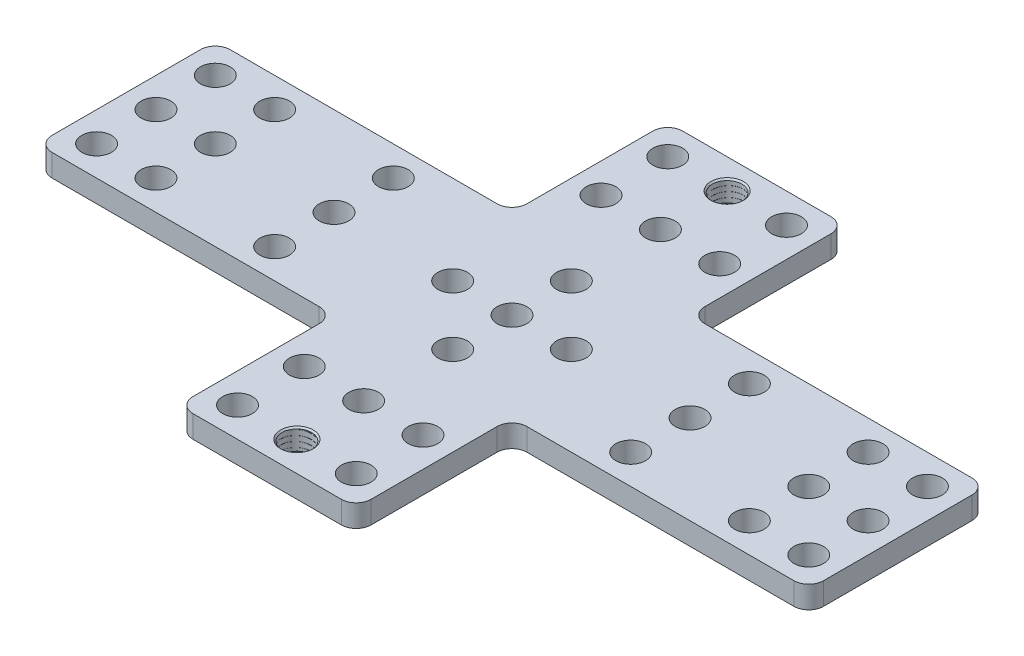
from build123d import *

# Parameters (mm, degrees)
SKETCH_1_R          = 2
EXTRUDE_1_DEPTH     = 3
SKETCH_2_R          = 2
CUT_EXTRUDE_1_DEPTH = 10
SKETCH_3_R          = 2
CUT_EXTRUDE_2_DEPTH = 10
SWEEP_1_PITCH       = 0.7


with BuildPart() as part:
    # 草图1 → 凸台-拉伸1 (new body)
    with BuildSketch(Plane(origin=(0, 0, 0), x_dir=(1, 0, 0), z_dir=(0, 1, 0))):
        with BuildLine():
            Line((-12, 14), (-12, 31))
            ThreePointArc((-12, 31), (-11.414213562, 32.414213562), (-10, 33))
            Line((-10, 33), (0, 33))
            Line((0, 33), (0, 31))
            ThreePointArc((0, 31), (-2, 29), (0, 27))
            Line((0, 27), (0, 10))
            ThreePointArc((0, 10), (-2, 8), (0, 6))
            Line((0, 6), (0, 2))
            ThreePointArc((0, 2), (-2, 0), (0, -2))
            Line((0, -2), (0, -6))
            ThreePointArc((0, -6), (-2, -8), (0, -10))
            Line((0, -10), (0, -27))
            ThreePointArc((0, -27), (-2, -29), (0, -31))
            Line((0, -31), (0, -33))
            Line((0, -33), (-10, -33))
            ThreePointArc((-10, -33), (-11.414213562, -32.414213562), (-12, -31))
            Line((-12, -31), (-12, -14))
            ThreePointArc((-12, -14), (-12.585786438, -12.585786438), (-14, -12))
            Line((-14, -12), (-50, -12))
            ThreePointArc((-50, -12), (-51.414213562, -11.414213562), (-52, -10))
            Line((-52, -10), (-52, 10))
            ThreePointArc((-52, 10), (-51.414213562, 11.414213562), (-50, 12))
            Line((-50, 12), (-14, 12))
            ThreePointArc((-14, 12), (-12.585786438, 12.585786438), (-12, 14))
        make_face()
        with Locations(Location((-48, 0, 0), (0, 0, 270))):
            Circle(SKETCH_1_R, mode=Mode.SUBTRACT)
        with Locations(Location((-48, -8, 0), (0, 0, 270))):
            Circle(SKETCH_1_R, mode=Mode.SUBTRACT)
        with Locations(Location((-40, -8, 0), (0, 0, 270))):
            Circle(SKETCH_1_R, mode=Mode.SUBTRACT)
        with Locations(Location((-40, 0, 0), (0, 0, 270))):
            Circle(SKETCH_1_R, mode=Mode.SUBTRACT)
        with Locations(Location((-48, 8, 0), (0, 0, 270))):
            Circle(SKETCH_1_R, mode=Mode.SUBTRACT)
        with Locations(Location((-40, 8, 0), (0, 0, 270))):
            Circle(SKETCH_1_R, mode=Mode.SUBTRACT)
        with Locations(Location((-8, 29, 0), (0, 0, 270))):
            Circle(SKETCH_1_R, mode=Mode.SUBTRACT)
        with Locations(Location((-8, -29, 0), (0, 0, 270))):
            Circle(SKETCH_1_R, mode=Mode.SUBTRACT)
        with Locations(Location((-8, 0, 0), (0, 0, 270))):
            Circle(SKETCH_1_R, mode=Mode.SUBTRACT)
    extrude_1 = extrude(amount=EXTRUDE_1_DEPTH)

    # 镜向1: 凸台-拉伸1 across plane
    add(extrude_1.mirror(Plane(origin=(0, 0, 0), x_dir=(0, 0, 1), z_dir=(1, 0, 0))))

    # 草图2 → 切除-拉伸1 (cut)
    with BuildSketch(Plane(origin=(0, 3, 0), x_dir=(1, 0, 0), z_dir=(0, 1, 0))):
        with Locations(Location((-24, 8, 0), (0, 0, 270))):
            Circle(SKETCH_2_R)
        with Locations(Location((-24, 0, 0), (0, 0, 270))):
            Circle(SKETCH_2_R)
        with Locations(Location((-24, -8, 0), (0, 0, 270))):
            Circle(SKETCH_2_R)
    cut_extrude_1 = extrude(amount=-CUT_EXTRUDE_1_DEPTH, mode=Mode.SUBTRACT)

    # 镜向2: 切除-拉伸1 across plane
    add(cut_extrude_1.mirror(Plane(origin=(0, 0, 0), x_dir=(0, 0, 1), z_dir=(1, 0, 0))), mode=Mode.SUBTRACT)

    # 草图3 → 切除-拉伸2 (cut)
    with BuildSketch(Plane(origin=(0, 3, 0), x_dir=(1, 0, 0), z_dir=(0, 1, 0))):
        with Locations(Location((-8, 20, 0), (0, 0, 270))):
            Circle(SKETCH_3_R)
        with Locations(Location((0, 20, 0), (0, 0, 270))):
            Circle(SKETCH_3_R)
        with Locations(Location((8, 20, 0), (0, 0, 270))):
            Circle(SKETCH_3_R)
    cut_extrude_2 = extrude(amount=-CUT_EXTRUDE_2_DEPTH, mode=Mode.SUBTRACT)

    # 切除-扫描1: arcs per turn and ends read off the stored shape
    # 切除-扫描1: the profile of 草图5 screwed along a right-hand helix through 6 turns, 6 arcs to a turn; built about Z, then put on its axis
    sweep_1_z = Axis((0, 0, 0), (0, 0, 1))
    sweep_1_corners = [(1.99, 0, -0.7), (2, 0, -0.71), (2.01, 0, -0.7), (2, 0, -0.69)]
    with BuildLine(mode=Mode.PRIVATE) as sweep_1_profile:
        ThreePointArc((1.99, 0, -0.7), (1.992928932, 0, -0.707071068), (2, 0, -0.71))
        ThreePointArc((2, 0, -0.71), (2.007071068, 0, -0.707071068), (2.01, 0, -0.7))
        ThreePointArc((2.01, 0, -0.7), (2.007071068, 0, -0.692928932), (2, 0, -0.69))
        ThreePointArc((2, 0, -0.69), (1.992928932, 0, -0.692928932), (1.99, 0, -0.7))
    sweep_1_cap = Face(sweep_1_profile.wire())
    sweep_1_arcs = [((1.99, 0, -0.7), (1.99, 0, -0.71), (2, 0, -0.71), (1, 0.7071067811865476, 1)), ((2, 0, -0.71), (2.01, 0, -0.71), (2.01, 0, -0.7), (1, 0.7071067811865476, 1)), ((2.01, 0, -0.7), (2.01, 0, -0.69), (2, 0, -0.69), (1, 0.7071067811865476, 1)), ((2, 0, -0.69), (1.99, 0, -0.69), (1.99, 0, -0.7), (1, 0.7071067811865476, 1))]  # start, shoulder, end, weights
    sweep_1_turn_angles = [0, 30, 60, 90, 120, 150, 180, 210, 240, 270, 300, 330, 360]
    sweep_1_turn_weights = [1, 0.8660254037844387, 1, 0.8660254037844387, 1, 0.8660254037844387, 1, 0.8660254037844387, 1, 0.8660254037844387, 1, 0.8660254037844387, 1]
    sweep_1_turn_sides = [Face.make_bezier_surface([[Vector(p[j][0], p[j][1], 0).rotate(sweep_1_z, sweep_1_turn_angles[2 * i + k]) / sweep_1_turn_weights[2 * i + k] + Vector(0, 0, p[j][2] + SWEEP_1_PITCH * sweep_1_turn_angles[2 * i + k] / 360) for k in range(3)] for j in range(3)], [[p[3][j] * sweep_1_turn_weights[2 * i + k] for k in range(3)] for j in range(3)]) for p in sweep_1_arcs for i in range(6)]
    sweep_1 = Plane(origin=(0, 3, 29), x_dir=(0, 0, 1), z_dir=(0, -1, 0)) * Solid(Shell([*[p.moved(Location((0, 0, SWEEP_1_PITCH * i))) for i in range(6) for p in sweep_1_turn_sides], sweep_1_cap, sweep_1_cap.rotate(sweep_1_z, 2160).moved(Location((0, 0, SWEEP_1_PITCH * 2160 / 360)))]))
    add(sweep_1, mode=Mode.SUBTRACT)

    # 镜向3: 切除-拉伸2, 切除-扫描1 across plane
    add(cut_extrude_2.mirror(Plane.XY), mode=Mode.SUBTRACT)
    add(sweep_1.mirror(Plane.XY), mode=Mode.SUBTRACT)

    # 倒角1: read off the stored shape, not the designer's step
    # 倒角1: loft between two sections, ruled curve by curve
    chamfer_1_from = [
        Edge.make_three_point_arc((0.192582955, 0.200000215, -30.990706143), (1.990706143, 0.200000215, -28.807417045), (-0.192582955, 0.200000215, -27.009293857)),
        Edge.make_three_point_arc((-0.192582955, 0.200000215, -27.009293857), (-1.990706143, 0.200000215, -29.192582955), (0.192582955, 0.200000215, -30.990706143)),
    ]
    chamfer_1_to = [
        Edge.make_three_point_arc((0.211841274, 0, -31.189776992), (2.189776992, 0, -28.788158726), (-0.211841274, 0, -26.810223008)),
        Edge.make_three_point_arc((-0.211841274, 0, -26.810223008), (-2.189776992, 0, -29.211841274), (0.211841274, 0, -31.189776992)),
    ]
    chamfer_1 = Solid(Shell([*[Face.make_surface_from_curves(chamfer_1_from[k], chamfer_1_to[k]) for k in range(2)], Face(Wire(chamfer_1_from)), Face(Wire(chamfer_1_to))]))
    add(chamfer_1, mode=Mode.SUBTRACT)

    # Chamfer 1 2: loft between two sections, ruled curve by curve
    chamfer_1_2_from = [
        Edge.make_three_point_arc((0.192582976, 0.2, 30.990706356), (-1.990706356, 0.2, 29.192582976), (-0.192582976, 0.2, 27.009293644)),
        Edge.make_three_point_arc((-0.192582976, 0.2, 27.009293644), (1.990706356, 0.2, 28.807417024), (0.192582976, 0.2, 30.990706356)),
    ]
    chamfer_1_2_to = [
        Edge.make_three_point_arc((0.211841274, 0, 31.189776992), (-2.189776992, 0, 29.211841274), (-0.211841274, 0, 26.810223008)),
        Edge.make_three_point_arc((-0.211841274, 0, 26.810223008), (2.189776992, 0, 28.788158726), (0.211841274, 0, 31.189776992)),
    ]
    chamfer_1_2 = Solid(Shell([*[Face.make_surface_from_curves(chamfer_1_2_from[k], chamfer_1_2_to[k]) for k in range(2)], Face(Wire(chamfer_1_2_from)), Face(Wire(chamfer_1_2_to))]))
    add(chamfer_1_2, mode=Mode.SUBTRACT)

    # Chamfer 1 3: loft between two sections, ruled curve by curve
    chamfer_1_3_from = [
        Edge.make_three_point_arc((-1.907878125, 2.799999751, 28.399999915), (-0.600000085, 2.799999751, 30.907878125), (1.907878125, 2.799999751, 29.600000085)),
        Edge.make_three_point_arc((1.907878125, 2.799999751, 29.600000085), (0.600000085, 2.799999751, 27.092121875), (-1.907878125, 2.799999751, 28.399999915)),
    ]
    chamfer_1_3_to = [
        Edge.make_three_point_arc((-2.098666198, 3, 28.339999825), (-0.660000175, 3, 31.098666198), (2.098666198, 3, 29.660000175)),
        Edge.make_three_point_arc((2.098666198, 3, 29.660000175), (0.660000175, 3, 26.901333802), (-2.098666198, 3, 28.339999825)),
    ]
    chamfer_1_3 = Solid(Shell([*[Face.make_surface_from_curves(chamfer_1_3_from[k], chamfer_1_3_to[k]) for k in range(2)], Face(Wire(chamfer_1_3_from)), Face(Wire(chamfer_1_3_to))]))
    add(chamfer_1_3, mode=Mode.SUBTRACT)

    # Chamfer 1 4: loft between two sections, ruled curve by curve
    chamfer_1_4_from = [
        Edge.make_three_point_arc((-1.983397573, 2.799997051, -28.742857455), (0.257142545, 2.799997051, -27.016602427), (1.983397573, 2.799997051, -29.257142545)),
        Edge.make_three_point_arc((1.983397573, 2.799997051, -29.257142545), (-0.257142545, 2.799997051, -30.983397573), (-1.983397573, 2.799997051, -28.742857455)),
    ]
    chamfer_1_4_to = [
        Edge.make_three_point_arc((-2.181740546, 3, -28.717142784), (0.282857216, 3, -26.818259454), (2.181740546, 3, -29.282857216)),
        Edge.make_three_point_arc((2.181740546, 3, -29.282857216), (-0.282857216, 3, -31.181740546), (-2.181740546, 3, -28.717142784)),
    ]
    chamfer_1_4 = Solid(Shell([*[Face.make_surface_from_curves(chamfer_1_4_from[k], chamfer_1_4_to[k]) for k in range(2)], Face(Wire(chamfer_1_4_from)), Face(Wire(chamfer_1_4_to))]))
    add(chamfer_1_4, mode=Mode.SUBTRACT)


solid = part.part
